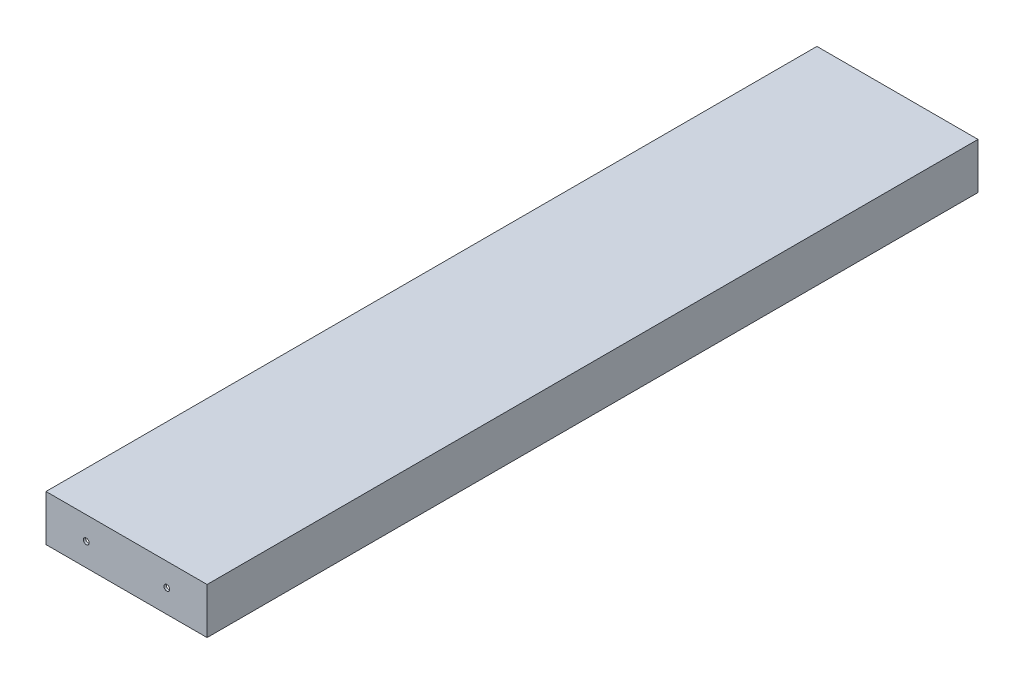
from build123d import *

# Parameters (mm, degrees)
SKETCH1_W           = 177.8
SKETCH1_H           = 50.8
BOSS_EXTRUDE1_DEPTH = 850.9
SHELL1_T            = -2.54
SKETCH2_R           = 3.175
CUT_EXTRUDE1_DEPTH  = 945.134


with BuildPart() as part:
    # Sketch1 → Boss-Extrude1 (new body)
    with BuildSketch(Plane.XY):
        with Locations((88.9, 25.4)):
            Rectangle(SKETCH1_W, SKETCH1_H)
    extrude(amount=BOSS_EXTRUDE1_DEPTH)

    # Shell1
    shell1_openings = [part.faces().sort_by_distance(p)[0] for p in [
        (88.9, 0, 425.45),
    ]]
    offset(amount=SHELL1_T, openings=shell1_openings, kind=Kind.INTERSECTION)

    # Sketch2 → Cut-Extrude1 (cut)
    with BuildSketch(Plane(origin=(0, 0, 0), x_dir=(-1, 0, 0), z_dir=(0, 0, -1))):
        with Locations((-133.35, 25.4)):
            Circle(SKETCH2_R)
        with Locations((-44.45, 25.4)):
            Circle(SKETCH2_R)
    extrude(amount=-CUT_EXTRUDE1_DEPTH, mode=Mode.SUBTRACT)


solid = part.part
